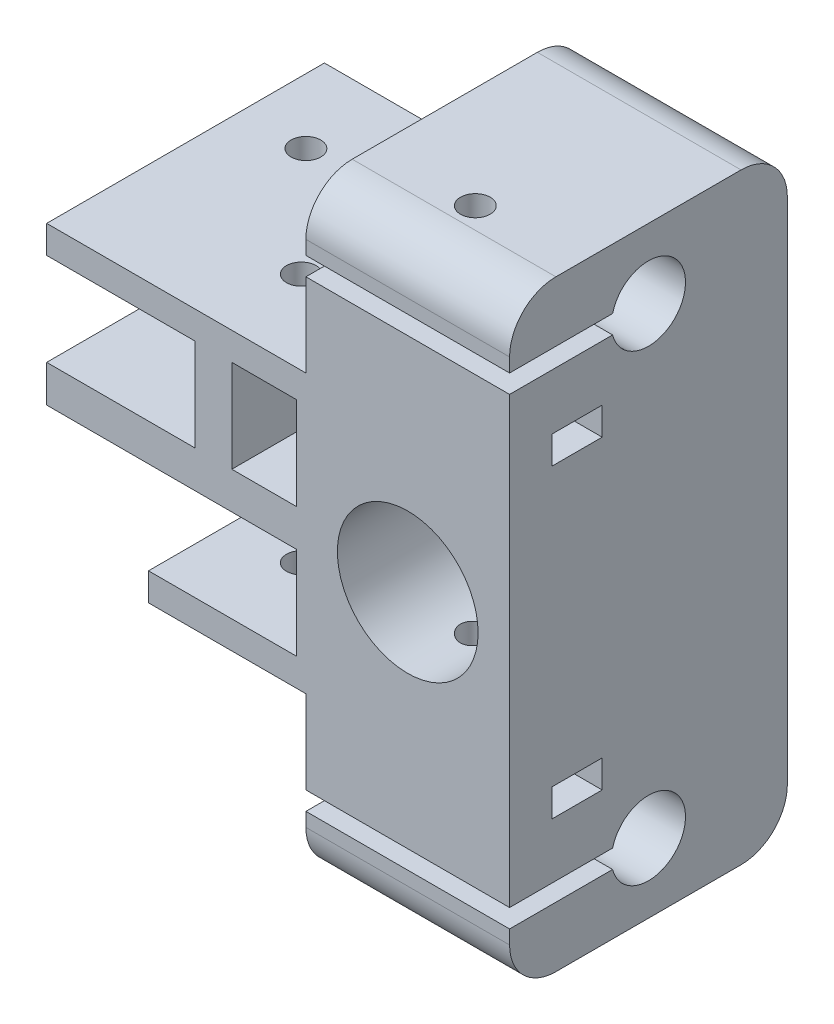
from build123d import *

# Parameters (mm, degrees)
ESBO_O2_R                  = 7.6
ESBO_O2_W                  = 7
ESBO_O2_H                  = 10
RESSALTO_EXTRUS_O1_DEPTH   = 30
ESBO_O3_W                  = 5.4
ESBO_O3_H                  = 3
CORTE_EXTRUS_O1_DEPTH      = 53.347397261
CORTE_EXTRUS_O2_DEPTH      = 69.390423306
CORTE_EXTRUS_O2_DEPTH_BACK = 69.390423306
ESBO_O4_R                  = 1.6
CORTE_EXTRUS_O3_DEPTH      = 82.523002889
CORTE_EXTRUS_O3_DEPTH_BACK = 82.523002889
ESBO_O5_R                  = 1.6
FILETE1_R                  = 5


with BuildPart() as part:
    # Esboço2 → Ressalto-extrusão1 (new body)
    with BuildSketch(Plane.XY):
        Polygon((-11, 15), (-11, 32.5), (11, 32.5), (11, -32.5), (-11, -32.5), (-11, -15), (-28, -15), (-28, -12), (-12, -12), (-12, -2), (-28, -2), (-39, -2), (-39, 2), (-23, 2), (-23, 12), (-39, 12), (-39, 15), align=None)
        Circle(ESBO_O2_R, mode=Mode.SUBTRACT)
        with Locations((-15.5, 7)):
            Rectangle(ESBO_O2_W, ESBO_O2_H, mode=Mode.SUBTRACT)
    extrude(amount=RESSALTO_EXTRUS_O1_DEPTH)

    # Esboço3 → Corte-extrusão1 (cut, through all)
    with BuildSketch(Plane.ZY.offset(11)):
        with Locations((22.7, 16.5)):
            Rectangle(ESBO_O3_W, ESBO_O3_H)
        with BuildLine():
            Line((18.872983346, 24), (32.741970983, 24))
            Line((32.741970983, 24), (32.741970983, 26))
            Line((32.741970983, 26), (18.872983346, 26))
            ThreePointArc((18.872983346, 26), (11, 25), (18.872983346, 24))
        make_face()
        with BuildLine():
            Line((32.741970983, -24), (32.741970983, -26))
            Line((32.741970983, -26), (18.872983346, -26))
            ThreePointArc((18.872983346, -26), (11, -25), (18.872983346, -24))
            Line((18.872983346, -24), (32.741970983, -24))
        make_face()
        with Locations((22.7, -16.5)):
            Rectangle(ESBO_O3_W, ESBO_O3_H)
    extrude(amount=-CORTE_EXTRUS_O1_DEPTH, mode=Mode.SUBTRACT)

    # Esboço4 → Corte-extrusão2 (cut, two sides: drawn at the far end of the back side and taken through both)
    with BuildSketch(Plane(origin=(0, 15, 0), x_dir=(1, 0, 0), z_dir=(0, 1, 0)).offset(-CORTE_EXTRUS_O2_DEPTH_BACK)):
        with Locations((-32, -9)):
            Circle(ESBO_O4_R)
        with Locations((-20.5, -21)):
            Circle(ESBO_O4_R)
    extrude(amount=CORTE_EXTRUS_O2_DEPTH + CORTE_EXTRUS_O2_DEPTH_BACK, mode=Mode.SUBTRACT)

    # Esboço5 → Corte-extrusão3 (cut, two sides: drawn at the far end of the back side and taken through both)
    with BuildSketch(Plane(origin=(0, 32.5, 0), x_dir=(1, 0, 0), z_dir=(0, 1, 0)).offset(-CORTE_EXTRUS_O3_DEPTH_BACK)):
        with Locations((0, -22.7)):
            Circle(ESBO_O5_R)
    extrude(amount=CORTE_EXTRUS_O3_DEPTH + CORTE_EXTRUS_O3_DEPTH_BACK, mode=Mode.SUBTRACT)

    # Filete1
    filete1_edges = [part.edges().sort_by_distance(p)[0] for p in [
        (0, -32.5, 30),
        (0, -32.5, 0),
        (0, 32.5, 30),
        (0, 32.5, 0),
    ]]
    fillet(filete1_edges, radius=FILETE1_R)


solid = part.part
